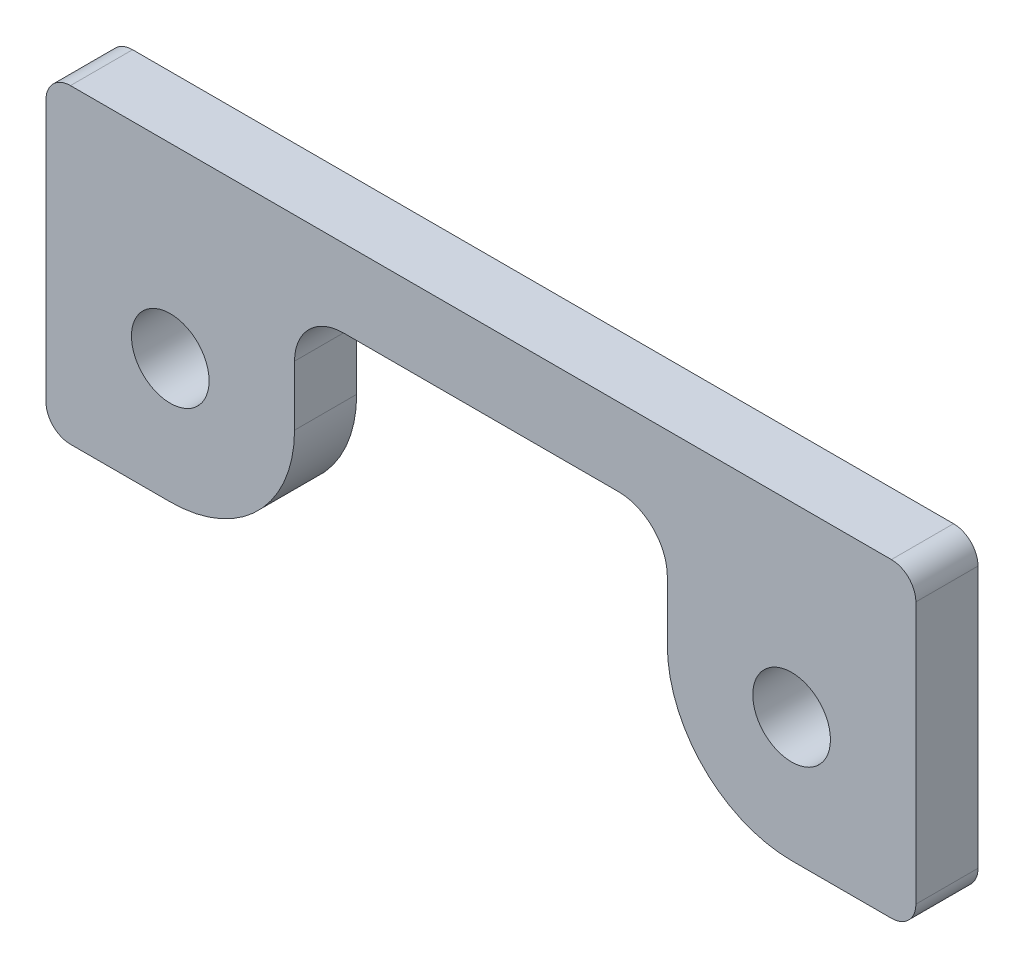
from build123d import *

# Parameters (mm, degrees)
SKETCH2_R               = 3.96875
BOSS_EXTRUDE1_DEPTH     = 6.35
CUT_EXTRUDE1_DEPTH      = 95.292689271
CUT_EXTRUDE1_DEPTH_BACK = 95.292689271
SKETCH3_R               = 3
SKETCH3_R_2             = 1.59


with BuildPart() as part:
    # Sketch2 → Boss-Extrude1 (new body)
    with BuildSketch(Plane.XY):
        with BuildLine():
            Line((2.5, 38.1), (86.4, 38.1))
            ThreePointArc((86.4, 38.1), (88.167766953, 37.367766953), (88.9, 35.6))
            Line((88.9, 35.6), (88.9, 8.85))
            ThreePointArc((88.9, 8.85), (88.167766953, 7.082233047), (86.4, 6.35))
            Line((86.4, 6.35), (76.2, 6.35))
            ThreePointArc((76.2, 6.35), (67.219743879, 10.069743879), (63.5, 19.05))
            Line((63.5, 19.05), (63.5, 25.16))
            ThreePointArc((63.5, 25.16), (62.035533906, 28.695533906), (58.5, 30.16))
            Line((58.5, 30.16), (30.4, 30.16))
            ThreePointArc((30.4, 30.16), (26.864466094, 28.695533906), (25.4, 25.16))
            Line((25.4, 25.16), (25.4, 19.05))
            ThreePointArc((25.4, 19.05), (21.680256121, 10.069743879), (12.7, 6.35))
            Line((12.7, 6.35), (2.5, 6.35))
            ThreePointArc((2.5, 6.35), (0.732233047, 7.082233047), (0, 8.85))
            Line((0, 8.85), (0, 35.6))
            ThreePointArc((0, 35.6), (0.732233047, 37.367766953), (2.5, 38.1))
        make_face()
        with Locations((12.7, 19.05)):
            Circle(SKETCH2_R, mode=Mode.SUBTRACT)
        with Locations((76.2, 19.05)):
            Circle(SKETCH2_R, mode=Mode.SUBTRACT)
    extrude(amount=BOSS_EXTRUDE1_DEPTH)

    # Sketch3 → Cut-Extrude1 (cut, two sides: drawn at the far end of the back side and taken through both)
    with BuildSketch(Plane(origin=(0, 15.875, -15.875), x_dir=(1, 0, 0), z_dir=(0, -0.7071067811865475, 0.7071067811865477)).offset(-CUT_EXTRUDE1_DEPTH_BACK)):
        with Locations((56.45, 21.326340521)):
            Circle(SKETCH3_R)
        with Locations((49.45, 21.326340521)):
            Circle(SKETCH3_R)
        with Locations((44.45, 21.326340521)):
            Circle(SKETCH3_R_2)
        with Locations((39.45, 21.326340521)):
            Circle(SKETCH3_R)
        with Locations((32.45, 21.326340521)):
            Circle(SKETCH3_R)
        with Locations((61.45, 21.326340521)):
            Circle(SKETCH3_R_2)
        with Locations((27.45, 21.326340521)):
            Circle(SKETCH3_R_2)
    extrude(amount=CUT_EXTRUDE1_DEPTH + CUT_EXTRUDE1_DEPTH_BACK, mode=Mode.SUBTRACT)


solid = part.part
